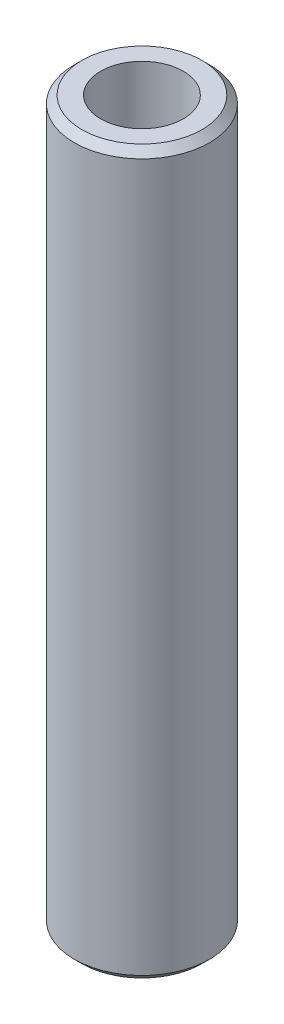
from build123d import *

# Parameters (mm, degrees)
SKETCH1_R           = 10
BOSS_EXTRUDE1_DEPTH = 106.854336888
SKETCH2_R           = 6.113969446
CUT_EXTRUDE1_DEPTH  = 108.78612764
CHAMFER1_SIZE       = 1.117053113


with BuildPart() as part:
    # Sketch1 → Boss-Extrude1 (new body)
    with BuildSketch(Plane(origin=(0, 0, 0), x_dir=(1, 0, 0), z_dir=(0, 1, 0))):
        Circle(SKETCH1_R)
    extrude(amount=BOSS_EXTRUDE1_DEPTH)

    # Sketch2 → Cut-Extrude1 (cut, through all)
    with BuildSketch(Plane(origin=(0, 0, 0), x_dir=(1, 0, 0), z_dir=(0, 1, 0))):
        Circle(SKETCH2_R)
    extrude(amount=CUT_EXTRUDE1_DEPTH, mode=Mode.SUBTRACT)

    # Chamfer1
    chamfer1_edges = [part.edges().sort_by_distance(p)[0] for p in [
        (-10, 106.854336888, 0),
        (-10, 0, 0),
    ]]
    chamfer(chamfer1_edges, length=CHAMFER1_SIZE)


solid = part.part
